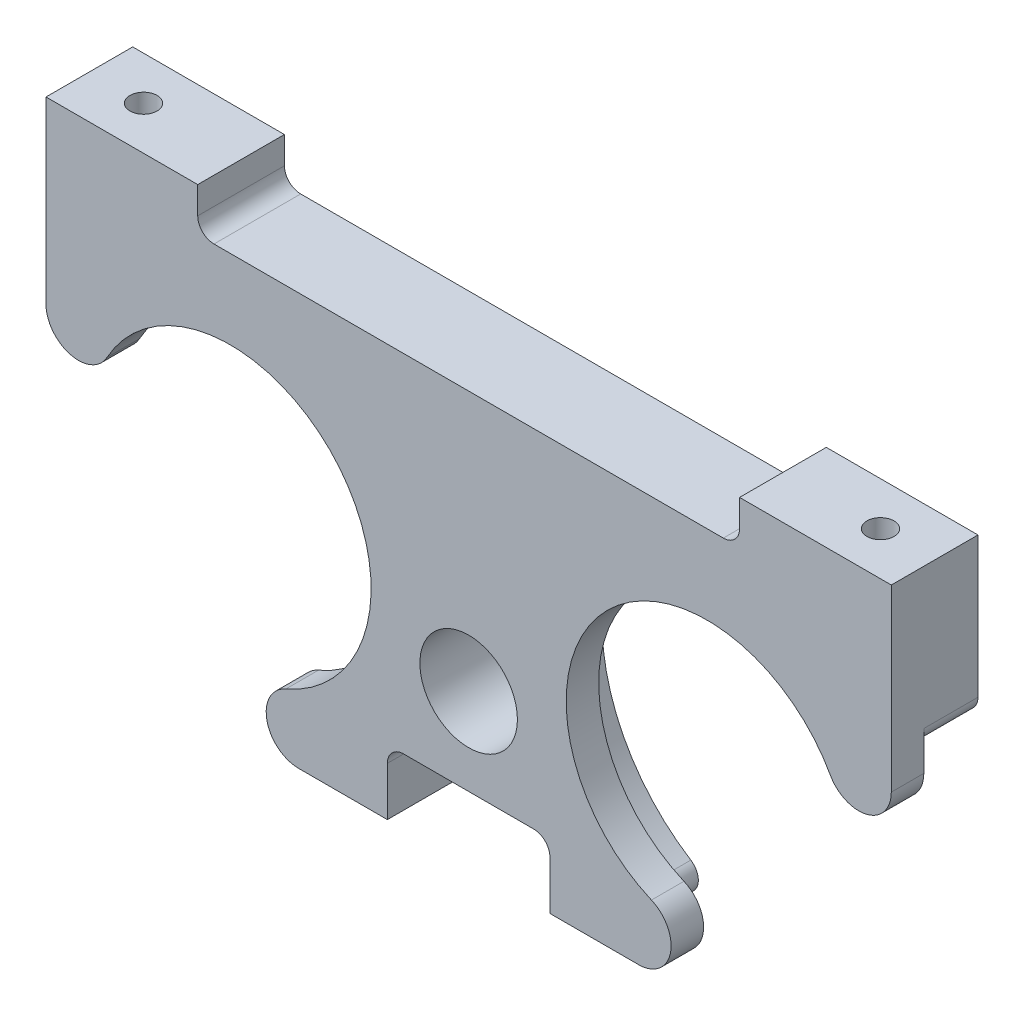
from build123d import *

# Parameters (mm, degrees)
SKETCH1_W                   = 78
SKETCH1_H                   = 42
BOSS_EXTRUDE1_DEPTH         = 8
CUT_EXTRUDE2_DEPTH          = 5
CUT_EXTRUDE3_REACH          = 59.871
SKETCH3_R                   = 4.5
CUT_EXTRUDE4_REACH          = 59.871
SKETCH4_W                   = 50
SKETCH4_H                   = 4
FILLET1_R                   = 1.5
TAP_DRILL_FOR_M3_TAP1_D     = 2.5
TAP_DRILL_FOR_M3_TAP1_DEPTH = 10
TAP_DRILL_FOR_M3_TAP1_TIP   = 0.751075774


with BuildPart() as part:
    # Sketch1 → Boss-Extrude1 (new body)
    with BuildSketch(Plane.XY):
        with Locations((0, 21)):
            Rectangle(SKETCH1_W, SKETCH1_H)
    extrude(amount=BOSS_EXTRUDE1_DEPTH)

    # Sketch2 → Cut-Extrude2 (cut)
    with BuildSketch(Plane(origin=(0, 0, 0), x_dir=(-1, 0, 0), z_dir=(0, 0, -1))):
        with BuildLine():
            Line((-39, 29.030931118), (-39, 0))
            Line((-39, 0), (-11.694661578, 0))
            ThreePointArc((-11.694661578, 0), (-13.134876405, 1.080737254), (-12.499766142, 2.765625))
            ThreePointArc((-12.499766142, 2.765625), (-9.086042487, 29.804532265), (-36.2890625, 28.145702124))
            ThreePointArc((-36.2890625, 28.145702124), (-37.965614513, 27.6050268), (-39, 29.030931118))
        make_face()
        with BuildLine():
            Line((39, 0), (39, 29.030931118))
            ThreePointArc((39, 29.030931118), (37.965614513, 27.6050268), (36.2890625, 28.145702124))
            ThreePointArc((36.2890625, 28.145702124), (9.086042487, 29.804532265), (12.499766142, 2.765625))
            ThreePointArc((12.499766142, 2.765625), (13.134876405, 1.080737254), (11.694661578, 0))
            Line((11.694661578, 0), (39, 0))
        make_face()
    extrude(amount=-CUT_EXTRUDE2_DEPTH, mode=Mode.SUBTRACT)

    # Sketch3 → Cut-Extrude3 (cut, up to next)
    with BuildSketch(Plane.XY.offset(8), mode=Mode.PRIVATE) as cut_extrude3_sk1:
        with Locations((0, 14)):
            Circle(SKETCH3_R)
    cut_extrude3_tool1 = extrude(cut_extrude3_sk1.sketch, amount=-CUT_EXTRUDE3_REACH, mode=Mode.PRIVATE) & part.part
    add(cut_extrude3_tool1.solids().sort_by_distance((0, 14, 8))[0], mode=Mode.SUBTRACT)

    # Sketch4 → Cut-Extrude4 (cut, up to next)
    with BuildSketch(Plane(origin=(0, 0, 0), x_dir=(-1, 0, 0), z_dir=(0, 0, -1)), mode=Mode.PRIVATE) as cut_extrude4_sk1:
        with BuildLine():
            Line((-39, 25.445966692), (-39, 0))
            Line((-39, 0), (-15.682563811, 0))
            ThreePointArc((-15.682563811, 0), (-18.620994515, 2.395330669), (-16.867083097, 5.75625))
            ThreePointArc((-16.867083097, 5.75625), (-12.361996301, 26.424040618), (-33.375, 23.993597938))
            ThreePointArc((-33.375, 23.993597938), (-36.75, 22.541229183), (-39, 25.445966692))
        make_face()
    cut_extrude4_tool1 = extrude(cut_extrude4_sk1.sketch, amount=-CUT_EXTRUDE4_REACH, mode=Mode.PRIVATE) & part.part
    # Sketch4 → Cut-Extrude4 (cut, up to next)
    with BuildSketch(Plane(origin=(0, 0, 0), x_dir=(-1, 0, 0), z_dir=(0, 0, -1)), mode=Mode.PRIVATE) as cut_extrude4_sk2:
        with BuildLine():
            Line((15.682563811, 0), (39, 0))
            Line((39, 0), (39, 25.445966692))
            ThreePointArc((39, 25.445966692), (36.75, 22.541229183), (33.375, 23.993597938))
            ThreePointArc((33.375, 23.993597938), (12.361996301, 26.424040618), (16.867083097, 5.75625))
            ThreePointArc((16.867083097, 5.75625), (18.620994515, 2.395330669), (15.682563811, 0))
        make_face()
    cut_extrude4_tool2 = extrude(cut_extrude4_sk2.sketch, amount=-CUT_EXTRUDE4_REACH, mode=Mode.PRIVATE) & part.part
    # Sketch4 → Cut-Extrude4 (cut, up to next)
    with BuildSketch(Plane(origin=(0, 0, 0), x_dir=(-1, 0, 0), z_dir=(0, 0, -1)), mode=Mode.PRIVATE) as cut_extrude4_sk3:
        with Locations((0, 40)):
            Rectangle(SKETCH4_W, SKETCH4_H)
    cut_extrude4_tool3 = extrude(cut_extrude4_sk3.sketch, amount=-CUT_EXTRUDE4_REACH, mode=Mode.PRIVATE) & part.part
    # Sketch4 → Cut-Extrude4 (cut, up to next)
    with BuildSketch(Plane(origin=(0, 0, 0), x_dir=(-1, 0, 0), z_dir=(0, 0, -1)), mode=Mode.PRIVATE) as cut_extrude4_sk4:
        with BuildLine():
            Line((-7.5, 0), (7.5, 0))
            Line((7.5, 0), (7.5, 4.5))
            ThreePointArc((7.5, 4.5), (7.060660172, 5.560660172), (6, 6))
            Line((6, 6), (-6, 6))
            ThreePointArc((-6, 6), (-7.060660172, 5.560660172), (-7.5, 4.5))
            Line((-7.5, 4.5), (-7.5, 0))
        make_face()
    cut_extrude4_tool4 = extrude(cut_extrude4_sk4.sketch, amount=-CUT_EXTRUDE4_REACH, mode=Mode.PRIVATE) & part.part
    add(cut_extrude4_tool1.solids().sort_by_distance((24.873987, 14.790062, 0))[0], mode=Mode.SUBTRACT)
    add(cut_extrude4_tool2.solids().sort_by_distance((-24.873987, 14.790062, 0))[0], mode=Mode.SUBTRACT)
    add(cut_extrude4_tool3.solids().sort_by_distance((0, 40, 0))[0], mode=Mode.SUBTRACT)
    add(cut_extrude4_tool4.solids().sort_by_distance((0, 2.971095, 0))[0], mode=Mode.SUBTRACT)

    # Fillet1
    fillet1_edges = [part.edges().sort_by_distance(p)[0] for p in [
        (-25, 38, 4),
        (25, 38, 4),
    ]]
    fillet(fillet1_edges, radius=FILLET1_R)

    # Tap Drill for M3 Tap1
    with Locations(Plane(origin=(0, 42, 0), x_dir=(-1, 0, 0), z_dir=(0, 1, 0))):
        with Locations((-34, 4), (34, 4)):
            Hole(TAP_DRILL_FOR_M3_TAP1_D / 2, depth=TAP_DRILL_FOR_M3_TAP1_DEPTH)
            with Locations((0, 0, -(TAP_DRILL_FOR_M3_TAP1_DEPTH + TAP_DRILL_FOR_M3_TAP1_TIP / 2))):  # 118° drill point
                Cone(0, TAP_DRILL_FOR_M3_TAP1_D / 2, TAP_DRILL_FOR_M3_TAP1_TIP, mode=Mode.SUBTRACT)


solid = part.part
